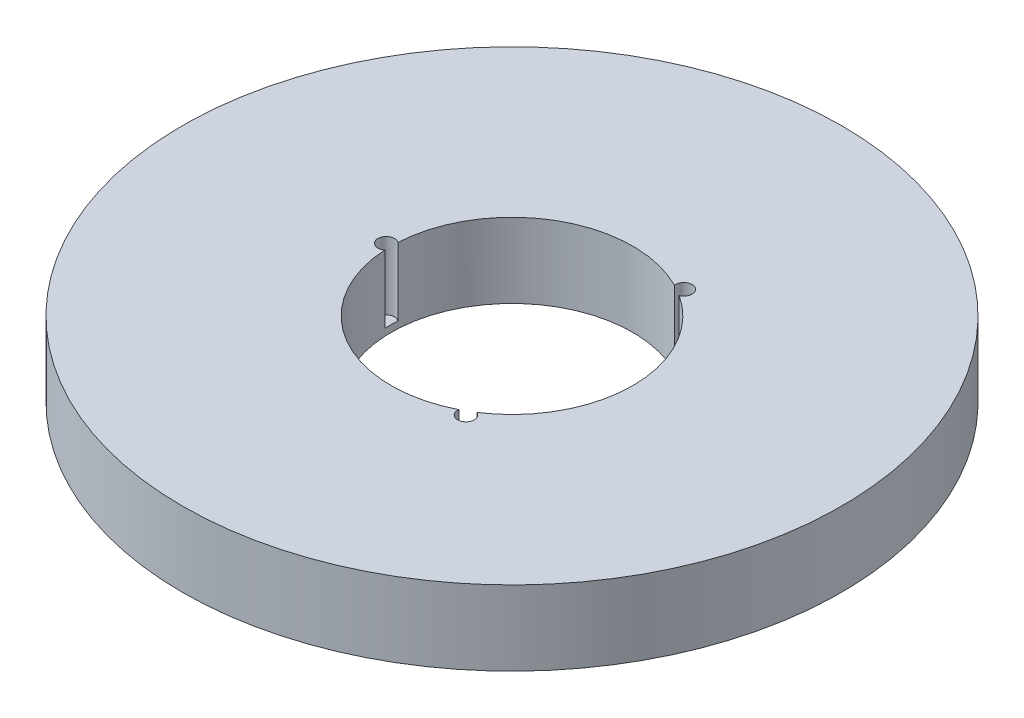
from build123d import *

# Parameters (mm, degrees)
SKETCH1_R           = 75
BOSS_EXTRUDE1_DEPTH = 17
SKETCH2_R           = 27.5
CUT_EXTRUDE1_DEPTH  = 108.419737479
SKETCH3_R           = 1.89538137
CUT_EXTRUDE2_DEPTH  = 15.462301149
CIRPATTERN1_COUNT   = 3


with BuildPart() as part:
    # Sketch1 → Boss-Extrude1 (new body)
    with BuildSketch(Plane(origin=(0, 0, 0), x_dir=(1, 0, 0), z_dir=(0, 1, 0))):
        Circle(SKETCH1_R)
    extrude(amount=BOSS_EXTRUDE1_DEPTH)

    # Sketch2 → Cut-Extrude1 (cut, through all)
    with BuildSketch(Plane(origin=(0, 0, 0), x_dir=(1, 0, 0), z_dir=(0, 1, 0))):
        Circle(SKETCH2_R)
    extrude(amount=CUT_EXTRUDE1_DEPTH, mode=Mode.SUBTRACT)

    # Sketch3 → Cut-Extrude2 (cut)
    with BuildSketch(Plane(origin=(0, 17, 0), x_dir=(1, 0, 0), z_dir=(0, 1, 0))):
        with Locations((-28.621358636, 0)):
            Circle(SKETCH3_R)
    cut_extrude2 = extrude(amount=-CUT_EXTRUDE2_DEPTH, mode=Mode.SUBTRACT)

    # CirPattern1: Cut-Extrude2 ×3 about axis
    cirpattern1_axis = Axis((0, 0, 0), (0, 1, 0))
    for i in range(1, CIRPATTERN1_COUNT):
        add(cut_extrude2.rotate(cirpattern1_axis, i * 360 / CIRPATTERN1_COUNT), mode=Mode.SUBTRACT)


solid = part.part
